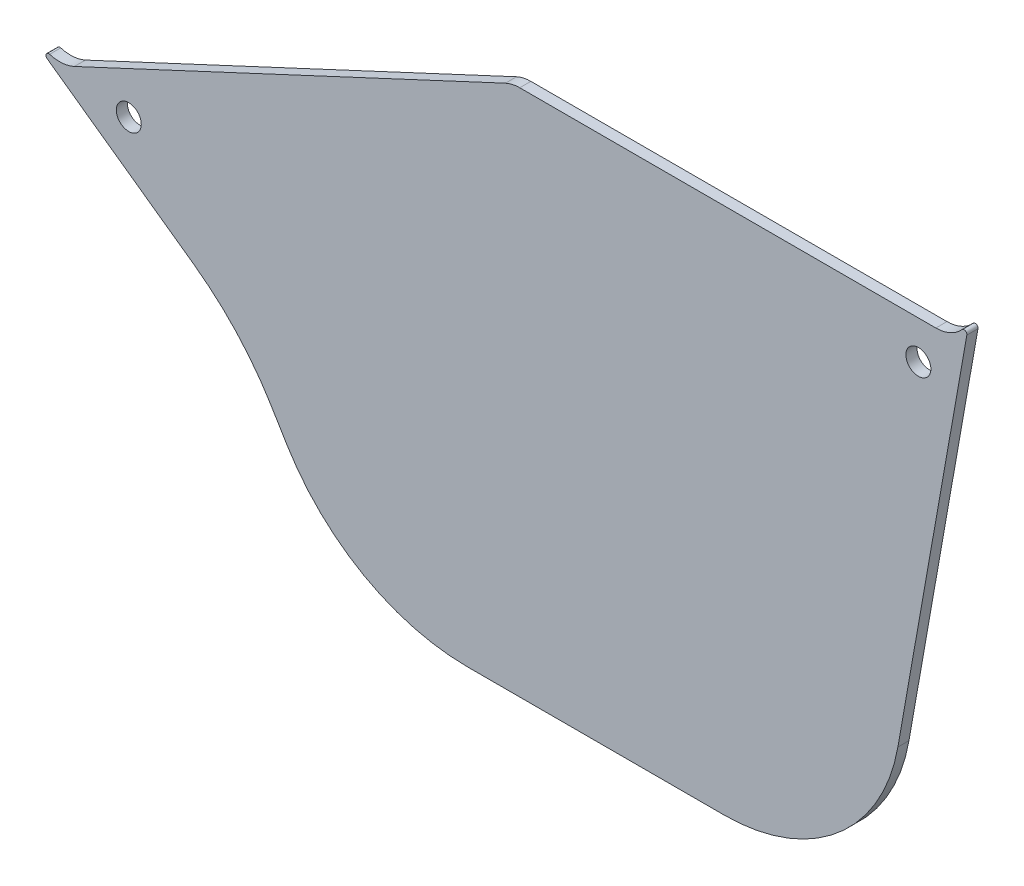
from build123d import *

# Parameters (mm, degrees)
BOSS_EXTRUDE1_OUTLINE_R = 2.2479
BOSS_EXTRUDE1_DEPTH     = 2
FILLET1_R               = 0.508


# Read off the part's stored shape, not the designer's step: Boss-Extrude1
with BuildPart() as part:
    # Boss-Extrude1 outline → Boss-Extrude1 (new body)
    with BuildSketch(Plane.XY.offset(-4.3)):
        with BuildLine():
            Line((-3.665078359, -78.538329641), (9.376516015, -4.575772565))
            ThreePointArc((9.376516015, -4.575772565), (7.222943475, -8.305869622), (3.175551027, -9.779))
            Line((3.175551027, -9.779), (-71.734942292, -9.779))
            ThreePointArc((-71.734942292, -9.779), (-73.054687902, -9.923572648), (-74.311835376, -10.350433227))
            Line((-74.311835376, -10.350433227), (-151.921287837, -46.550785133))
            ThreePointArc((-151.921287837, -46.550785133), (-156.284298691, -46.904620517), (-159.820994296, -44.325309098))
            ThreePointArc((-159.820994296, -44.325309098), (-158.24873565, -46.442088317), (-156.273248149, -48.188570679))
            Line((-156.273248149, -48.188570679), (-130.476004779, -66.603469659))
            ThreePointArc((-130.476004779, -66.603469659), (-122.742535166, -73.406833136), (-116.540360394, -81.630295604))
            Line((-116.540360394, -81.630295604), (-113.642182841, -86.414778297))
            ThreePointArc((-113.642182841, -86.414778297), (-99.756521843, -99.869092495), (-81.054590835, -104.775))
            Line((-81.054590835, -104.775), (-34.932724517, -104.775))
            ThreePointArc((-34.932724517, -104.775), (-14.52421791, -97.346911069), (-3.665078359, -78.538329641))
        make_face()
        with Locations((-142.126033439, -49.549218379)):
            Circle(BOSS_EXTRUDE1_OUTLINE_R, mode=Mode.SUBTRACT)
        with Locations((0.028082134, -16.637)):
            Circle(BOSS_EXTRUDE1_OUTLINE_R, mode=Mode.SUBTRACT)
    extrude(amount=BOSS_EXTRUDE1_DEPTH)

    # Fillet1
    fillet1_edges = [part.edges().sort_by_distance(p)[0] for p in [
        (9.376516015, -4.575772565, -3.3),
        (-159.820994296, -44.325309098, -3.3),
    ]]
    fillet(fillet1_edges, radius=FILLET1_R)


solid = part.part
